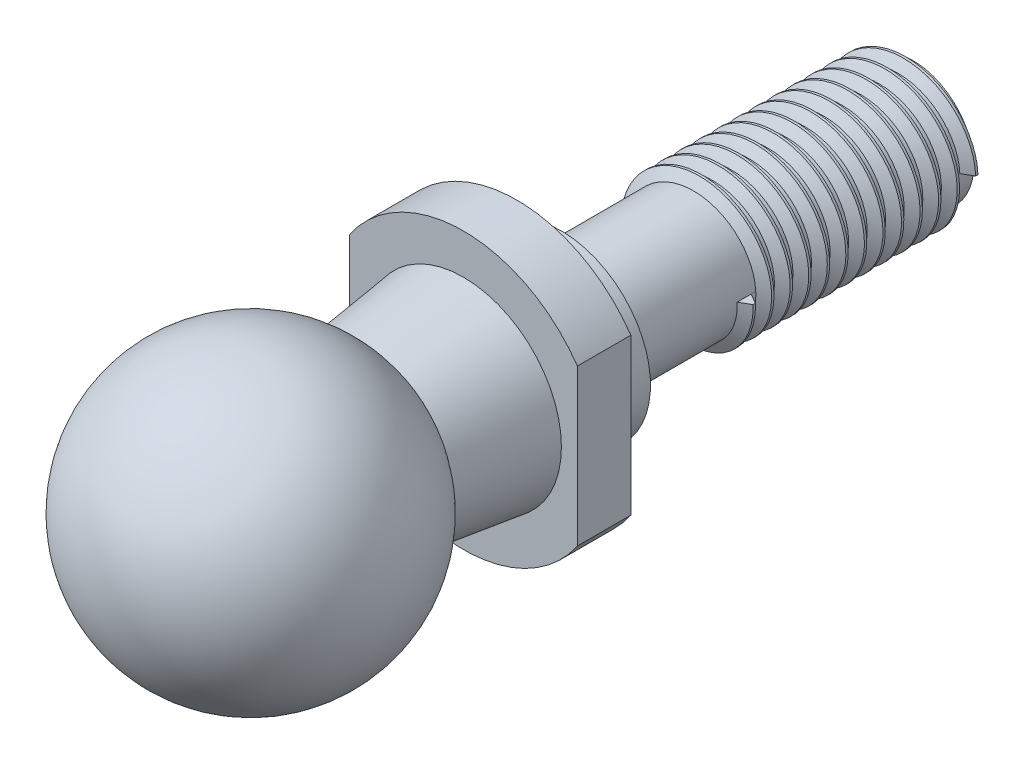
from build123d import *

# Parameters (mm, degrees)
BOSS_EXTRUDE1_DEPTH = 3.048
SKETCH4_R           = 5.08
BOSS_EXTRUDE2_DEPTH = 2.54
SKETCH5_R           = 3.4544
BOSS_EXTRUDE3_DEPTH = 20.066
THREAD1_PITCH       = 1.058333333


with BuildPart() as part:
    # Sketch1 → Revolve1 (revolve)
    with BuildSketch(Plane(origin=(0, 0, 0), x_dir=(0, 0, -1), z_dir=(1, 0, 0))):
        with BuildLine():
            Line((0, 8.255), (0, -8.255))
            ThreePointArc((0, -8.255), (-8.255, 0), (0, 8.255))
        make_face()
    revolve(axis=Axis((0, 8.255, 0), (0, -1, 0)))

    # Sketch2 → Revolve3 (revolve)
    with BuildSketch(Plane(origin=(0, 0, 0), x_dir=(0, 0, -1), z_dir=(1, 0, 0)), mode=Mode.PRIVATE) as revolve3_sk:
        Polygon((6.656359183, 4.882407953), (6.656359183, 0), (12.138187227, 0), (12.138187227, 5.588), align=None)
    revolve(revolve3_sk.sketch.rotate(Axis((0, 0, -6.656359183), (0, 0, -1)), 90), axis=Axis((0, 0, -6.656359183), (0, 0, -1)))

    # Sketch3 → Boss-Extrude1 (add)
    with BuildSketch(Plane(origin=(0, 0, -12.138187227), x_dir=(-1, 0, 0), z_dir=(0, 0, -1))):
        with BuildLine():
            Line((-6.499373124, 4.445), (-6.499373124, -4.445))
            ThreePointArc((-6.499373124, -4.445), (0, -7.874), (6.499373124, -4.445))
            Line((6.499373124, -4.445), (6.499373124, 4.445))
            ThreePointArc((6.499373124, 4.445), (0, 7.874), (-6.499373124, 4.445))
        make_face()
    extrude(amount=BOSS_EXTRUDE1_DEPTH)

    # Sketch4 → Boss-Extrude2 (add)
    with BuildSketch(Plane(origin=(0, 0, -15.186187227), x_dir=(-1, 0, 0), z_dir=(0, 0, -1))):
        Circle(SKETCH4_R)
    extrude(amount=BOSS_EXTRUDE2_DEPTH)

    # Sketch5 → Boss-Extrude3 (add)
    with BuildSketch(Plane(origin=(0, 0, -17.726187227), x_dir=(-1, 0, 0), z_dir=(0, 0, -1))):
        Circle(SKETCH5_R)
    extrude(amount=BOSS_EXTRUDE3_DEPTH)

    # Thread1: the profile of Thread Profile1 profile screwed along a right-hand helix of 12 turns, 8 arcs to a turn; built about Z, then put on its axis
    thread1_z = Axis((0, 0, 0), (0, 0, 1))
    thread1_corners = [(3.4541, 0, -0.000173205), (4.027239718, 0, 0.330729165), (4.027239718, 0, 0.463020832), (3.4541, 0, 0.793923202)]
    with BuildLine(mode=Mode.PRIVATE) as thread1_profile:
        Line(thread1_corners[0], thread1_corners[1])
        Line(thread1_corners[1], thread1_corners[2])
        Line(thread1_corners[2], thread1_corners[3])
        Line(thread1_corners[3], thread1_corners[0])
    thread1_cap = Face(thread1_profile.wire())
    thread1_turn_angles = [0, 22.5, 45, 67.5, 90, 112.5, 135, 157.5, 180, 202.5, 225, 247.5, 270, 292.5, 315, 337.5, 360]
    thread1_turn_weights = [1, 0.9238795325112867, 1, 0.9238795325112867, 1, 0.9238795325112867, 1, 0.9238795325112867, 1, 0.9238795325112867, 1, 0.9238795325112867, 1, 0.9238795325112867, 1, 0.9238795325112867, 1]
    thread1_turn_rails = [Edge.make_bspline([Vector(p[0], p[1], 0).rotate(thread1_z, thread1_turn_angles[k]) / thread1_turn_weights[k] + Vector(0, 0, p[2] + THREAD1_PITCH * thread1_turn_angles[k] / 360) for k in range(17)], [0, 0, 0, 1, 1, 2, 2, 3, 3, 4, 4, 5, 5, 6, 6, 7, 7, 8, 8, 8], 2, thread1_turn_weights) for p in thread1_corners]
    thread1_turn_sides = [Face.make_surface_from_curves(thread1_turn_rails[p[0]], thread1_turn_rails[p[1]]) for p in [(0, 1), (1, 2), (2, 3), (3, 0)]]
    thread1 = Plane(origin=(0, 0, -37.792187227), x_dir=(1, 0, 0), z_dir=(0, 0, 1)) * Solid(Shell([*[p.moved(Location((0, 0, THREAD1_PITCH * i))) for i in range(12) for p in thread1_turn_sides], thread1_cap, thread1_cap.rotate(thread1_z, 4320).moved(Location((0, 0, THREAD1_PITCH * 4320 / 360)))]))
    add(thread1)


solid = part.part
